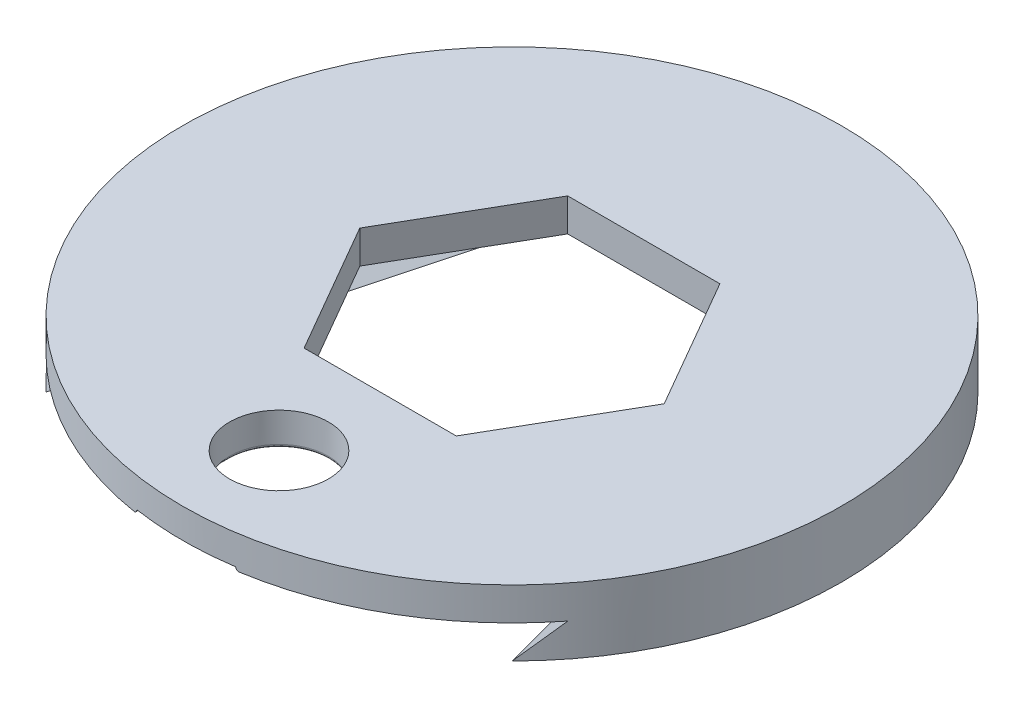
from build123d import *

# Parameters (mm, degrees)
SKETCH1_R               = 50
BOSS_EXTRUDE1_DEPTH     = 5
BOSS_EXTRUDE2_START     = -5
BOSS_EXTRUDE2_DEPTH     = 5
DRAFT1_ANGLE            = -45
CUT_EXTRUDE2_DEPTH      = 71.887234394
CUT_EXTRUDE2_DEPTH_BACK = 71.887234394
SKETCH1_8_R             = 7.5
CUT_EXTRUDE3_DEPTH      = 71.887234394
CUT_EXTRUDE4_DEPTH      = 0.5
FILLET1_R               = 0.5


with BuildPart() as part:
    # Sketch1 → Boss-Extrude1 (new body)
    with BuildSketch(Plane(origin=(0, 0, 0), x_dir=(1, 0, 0), z_dir=(0, 1, 0))):
        with Locations(Location((0, 0, 0), (0, 0, 270))):
            Circle(SKETCH1_R)
    extrude(amount=BOSS_EXTRUDE1_DEPTH)

    # Sketch1<5> → Boss-Extrude2 (add)
    with BuildSketch(Plane(origin=(0, 0, 0), x_dir=(1, 0, 0), z_dir=(0, 1, 0)).offset(BOSS_EXTRUDE2_START)):
        with BuildLine():
            Line((12.940952255, 48.296291314), (35.355339059, -35.355339059))
            ThreePointArc((35.355339059, -35.355339059), (46.193976626, -19.134171618), (50, 0))
            ThreePointArc((50, 0), (39.667667015, 30.43807145), (12.940952255, 48.296291314))
        make_face()
        with BuildLine():
            ThreePointArc((-12.940952255, 48.296291314), (-48.296291314, 12.940952255), (-35.355339059, -35.355339059))
            Line((-35.355339059, -35.355339059), (-12.940952255, 48.296291314))
        make_face()
    extrude(amount=BOSS_EXTRUDE2_DEPTH)

    # Draft1
    draft1_faces = [part.faces().sort_by_distance(p)[0] for p in [
        (24.148145657, -2.5, -6.470476128),
        (-24.148145657, -2.5, -6.470476128),
    ]]
    draft(draft1_faces, Plane(origin=(0, -5, 0), x_dir=(0, 0, -1), z_dir=(0, -1, 0)), DRAFT1_ANGLE)

    # Sketch1<8> → Cut-Extrude2 (cut, two sides: drawn at the far end of the back side and taken through both)
    with BuildSketch(Plane(origin=(0, 0, 0), x_dir=(1, 0, 0), z_dir=(0, 1, 0)).offset(-CUT_EXTRUDE2_DEPTH_BACK)):
        with Locations(Location((0, -35.355339059, 0), (0, 0, 270))):
            Circle(SKETCH1_8_R)
    extrude(amount=CUT_EXTRUDE2_DEPTH + CUT_EXTRUDE2_DEPTH_BACK, mode=Mode.SUBTRACT)

    # Sketch2 → Cut-Extrude3 (cut, through all)
    with BuildSketch(Plane.XZ):
        Polygon((23.094010768, 0), (11.547005384, 20), (-11.547005384, 20), (-23.094010768, 0), (-11.547005384, -20), (11.547005384, -20), align=None)
    extrude(amount=-CUT_EXTRUDE3_DEPTH, mode=Mode.SUBTRACT)

    # Sketch3 → Cut-Extrude4 (cut)
    with BuildSketch(Plane.XZ):
        with BuildLine():
            ThreePointArc((-7.5, 35.355339059), (0, 42.855339059), (7.5, 35.355339059))
            Line((7.5, 35.355339059), (7.5, 49.434299833))
            ThreePointArc((7.5, 49.434299833), (0, 50), (-7.5, 49.434299833))
            Line((-7.5, 49.434299833), (-7.5, 35.355339059))
        make_face()
    extrude(amount=-CUT_EXTRUDE4_DEPTH, mode=Mode.SUBTRACT)

    # Fillet1
    fillet1_edges = [part.edges().sort_by_distance(p)[0] for p in [
        (0, 0, 27.855339059),
        (-7.5, 0, 42.394819446),
        (7.5, 0, 42.394819446),
    ]]
    fillet(fillet1_edges, radius=FILLET1_R - 0.0001)  # a hair under: the kernel refuses the full size


solid = part.part
